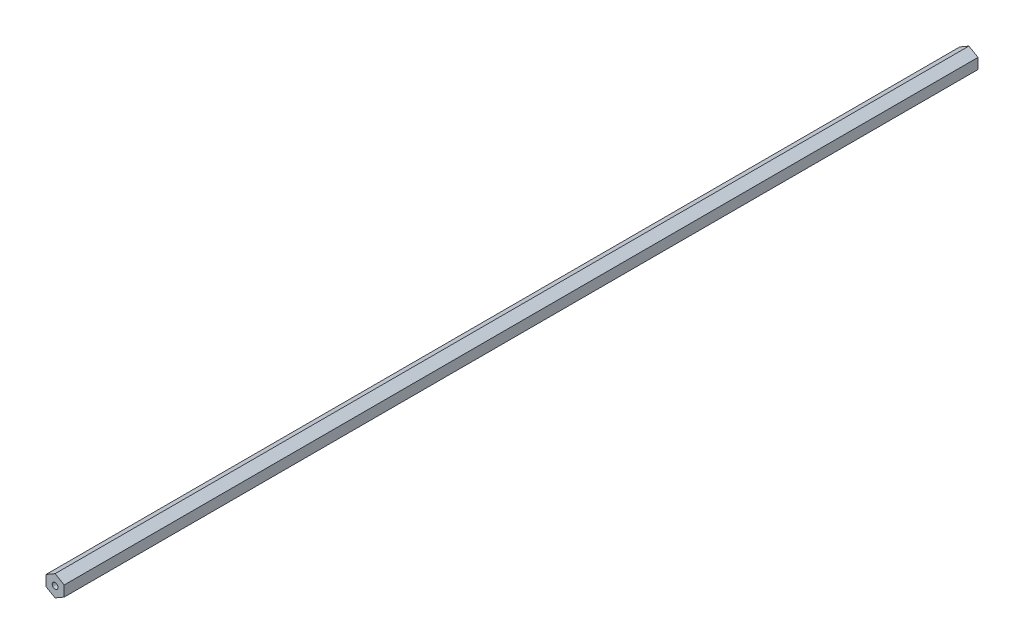
from build123d import *

# Parameters (mm, degrees)
BOSS_EXTRUDE1_DEPTH                  = 318.8335
F_10_32_TAPPED_HOLE1_D               = 4.0386
F_10_32_TAPPED_HOLE1_DEPTH           = 16.34744
F_10_32_TAPPED_HOLE1_TIP             = 1.213317848
F_10_32_TAPPED_HOLE1_ON_FACE_2_D     = 4.0386
F_10_32_TAPPED_HOLE1_ON_FACE_2_DEPTH = 16.34744
F_10_32_TAPPED_HOLE1_ON_FACE_2_TIP   = 1.213317848


with BuildPart() as part:
    # Sketch1 → Boss-Extrude1 (new, symmetric)
    with BuildSketch(Plane.XY):
        Polygon((6.35, -3.666174209), (6.35, 3.666174209), (0, 7.332348419), (-6.35, 3.666174209), (-6.35, -3.666174209), (0, -7.332348419), align=None)
    extrude(amount=BOSS_EXTRUDE1_DEPTH, both=True)

    # #10-32 Tapped Hole1
    with Locations(Plane.XY.offset(318.8335)):
        with Locations((0, 0)):
            Hole(F_10_32_TAPPED_HOLE1_D / 2, depth=F_10_32_TAPPED_HOLE1_DEPTH)
            with Locations((0, 0, -(F_10_32_TAPPED_HOLE1_DEPTH + F_10_32_TAPPED_HOLE1_TIP / 2))):  # 118° drill point
                Cone(0, F_10_32_TAPPED_HOLE1_D / 2, F_10_32_TAPPED_HOLE1_TIP, mode=Mode.SUBTRACT)

    # #10-32 Tapped Hole1 on face 2
    with Locations(Plane(origin=(0, 0, -318.8335), x_dir=(-1, 0, 0), z_dir=(0, 0, -1))):
        with Locations((0, 0)):
            Hole(F_10_32_TAPPED_HOLE1_ON_FACE_2_D / 2, depth=F_10_32_TAPPED_HOLE1_ON_FACE_2_DEPTH)
            with Locations((0, 0, -(F_10_32_TAPPED_HOLE1_ON_FACE_2_DEPTH + F_10_32_TAPPED_HOLE1_ON_FACE_2_TIP / 2))):  # 118° drill point
                Cone(0, F_10_32_TAPPED_HOLE1_ON_FACE_2_D / 2, F_10_32_TAPPED_HOLE1_ON_FACE_2_TIP, mode=Mode.SUBTRACT)


solid = part.part
